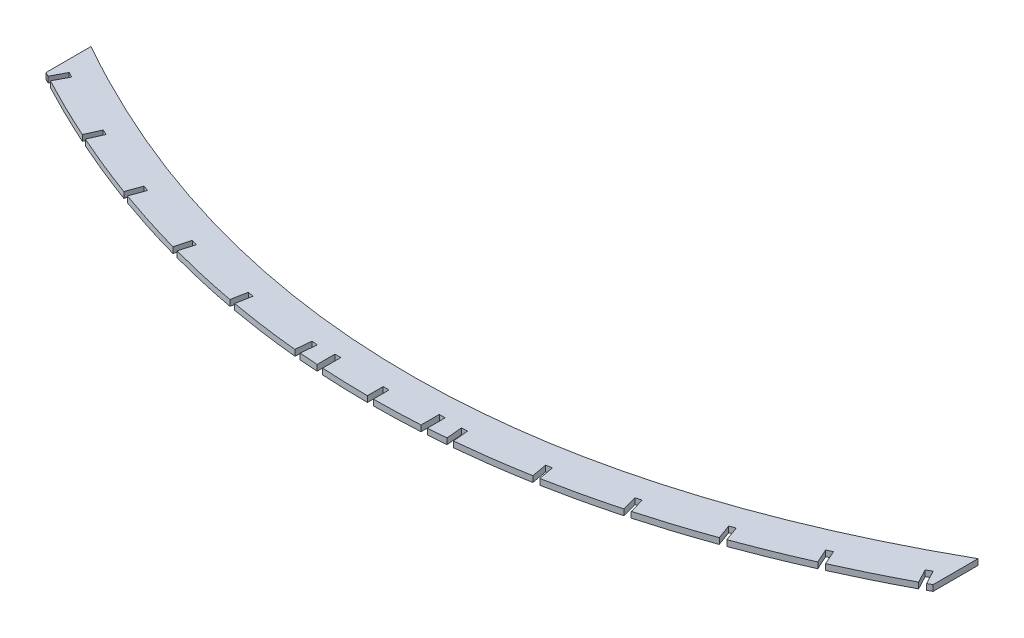
from build123d import *

# Parameters (mm, degrees)
BOSS_EXTRUDE1_DEPTH = 3
SKETCH2_W           = 3
SKETCH2_H           = 20
CUT_EXTRUDE1_DEPTH  = 316.221539489
CRVPATTERN1_DEPTH   = 3
SKETCH3_W           = 3
SKETCH3_H           = 20
CUT_EXTRUDE2_DEPTH  = 316.219666611


# Read off the part's stored shape, not the designer's step: CrvPattern1
with BuildPart() as part:
    # Sketch1 → Boss-Extrude1 (new body)
    with BuildSketch(Plane(origin=(0, 0, 0), x_dir=(1, 0, 0), z_dir=(0, 1, 0))):
        with BuildLine():
            Line((-225.24513062, -137.154537769), (-225.24513062, -159.985292155))
            add(Edge.make_bspline(
                [(-225.24513062, -159.985292155), (-224.638704882, -160.312036319), (-223.057460958, -161.160534764), (-216.624057366, -164.575831094), (-205.930649428, -170.027235677), (-191.337647411, -176.953321412), (-171.849962754, -185.517537629), (-147.437503569, -194.959486893), (-118.062116783, -204.255407475), (-88.61573526, -211.503073846), (-49.276909373, -218.419482826), (0, -221.887011449), (49.276909373, -218.419482826), (88.61573526, -211.503073846), (118.062116783, -204.255407475), (147.437503569, -194.959486893), (171.849962754, -185.517537629), (191.337647411, -176.953321412), (205.930649428, -170.027235677), (216.624057366, -164.575831094), (223.057460957, -161.160534764), (224.638704881, -160.31203632), (225.245130619, -159.985292156)],
                knots=[0.496190086, 0.496190086, 0.496190086, 0.496190086, 0.49622116, 0.496271117, 0.496519709, 0.496768301, 0.497016893, 0.497514078, 0.498011262, 0.498508447, 0.499005631, 0.5, 0.500994369, 0.501491553, 0.501988738, 0.502485922, 0.502983107, 0.503231699, 0.503480291, 0.503728883, 0.50377884, 0.503809914, 0.503809914, 0.503809914, 0.503809914], degree=3))
            Line((225.245130619, -159.985292156), (225.24513062, -137.154537769))
            add(Edge.make_bspline(
                [(-225.24513062, -137.154537769), (-222.908176033, -138.469074724), (-218.204067638, -141.07390287), (-208.827276173, -146.10094494), (-197.095113634, -152.081763048), (-183.020628451, -158.761564514), (-164.252323786, -167.009400213), (-140.791197461, -176.082259845), (-112.635650998, -184.99089612), (-84.478435277, -191.920233494), (-46.93358165, -198.519950199), (0, -201.8200332), (46.93358165, -198.519950199), (84.478435277, -191.920233494), (112.635650998, -184.99089612), (140.791197461, -176.082259845), (164.252323786, -167.009400213), (183.020628451, -158.761564514), (197.095113634, -152.081763048), (208.827276173, -146.10094494), (218.204067638, -141.07390287), (222.908176033, -138.469074724), (225.24513062, -137.154537769)],
                knots=[0.496022524, 0.496022524, 0.496022524, 0.496022524, 0.49614682, 0.496271117, 0.496519709, 0.496768301, 0.497016893, 0.497514078, 0.498011262, 0.498508447, 0.499005631, 0.5, 0.500994369, 0.501491553, 0.501988738, 0.502485922, 0.502983107, 0.503231699, 0.503480291, 0.503728883, 0.50385318, 0.503977476, 0.503977476, 0.503977476, 0.503977476], degree=3))
        make_face()
    extrude(amount=BOSS_EXTRUDE1_DEPTH)

    # Sketch2 → Cut-Extrude1 (cut, through all)
    with BuildSketch(Plane(origin=(0, 3, 0), x_dir=(1, 0, 0), z_dir=(0, 1, 0))):
        with Locations((0, -222.5)):
            Rectangle(SKETCH2_W, SKETCH2_H)
    extrude(amount=-CUT_EXTRUDE1_DEPTH, mode=Mode.SUBTRACT)

    # CrvPattern1 outline → CrvPattern1 (cut)
    with BuildSketch(Plane(origin=(0, 0, 0), x_dir=(1, 0, 0), z_dir=(0, 1, 0))):
        Polygon((-220.467963778, -162.531658727), (-216.719984026, -155.466091444), (-219.370201398, -154.060265039), (-223.118179341, -161.125828912), (-225, -164.673374886), (-225, -171.075303297), align=None)
        Polygon((-188.725830694, -178.053258243), (-207.495340178, -220), (-204.208702383, -220), (-185.98746806, -179.278562322), (-182.720820789, -171.978147273), (-185.459181559, -170.752839029), align=None)
        Polygon((-153.112430854, -192.581829804), (-163.032849301, -220), (-159.842517384, -220), (-150.291406472, -193.602526349), (-147.570303537, -186.081909775), (-150.391326627, -185.061209659), align=None)
        Polygon((-40.41021089, -220), (-37.397471697, -220), (-37.291018649, -218.846089208), (-36.556368917, -210.882763898), (-39.543683592, -210.60717175), (-40.278335291, -218.570518374), align=None)
        Polygon((-116.372691355, -204.382489462), (-120.648503047, -220), (-117.53809872, -220), (-113.479174795, -205.17467752), (-111.367292224, -197.46097292), (-114.260806719, -196.668777321), align=None)
        Polygon((-79.938345197, -220), (-76.888122716, -220), (-75.726615816, -213.678672516), (-74.281323322, -205.812884404), (-77.231927762, -205.27072812), (-78.67721995, -213.136514567), align=None)
    crvpattern1 = extrude(amount=CRVPATTERN1_DEPTH, mode=Mode.SUBTRACT)

    # Mirror1: CrvPattern1 across plane
    add(crvpattern1.mirror(Plane(origin=(0, 0, 0), x_dir=(0, 0, 1), z_dir=(1, 0, 0))), mode=Mode.SUBTRACT)

    # Sketch3 → Cut-Extrude2 (cut, through all)
    with BuildSketch(Plane(origin=(0, 3, 0), x_dir=(1, 0, 0), z_dir=(0, 1, 0))):
        with Locations((-26.5, -220.5)):
            Rectangle(SKETCH3_W, SKETCH3_H)
        with Locations((26.5, -220.5)):
            Rectangle(SKETCH3_W, SKETCH3_H)
    extrude(amount=-CUT_EXTRUDE2_DEPTH, mode=Mode.SUBTRACT)


solid = part.part
